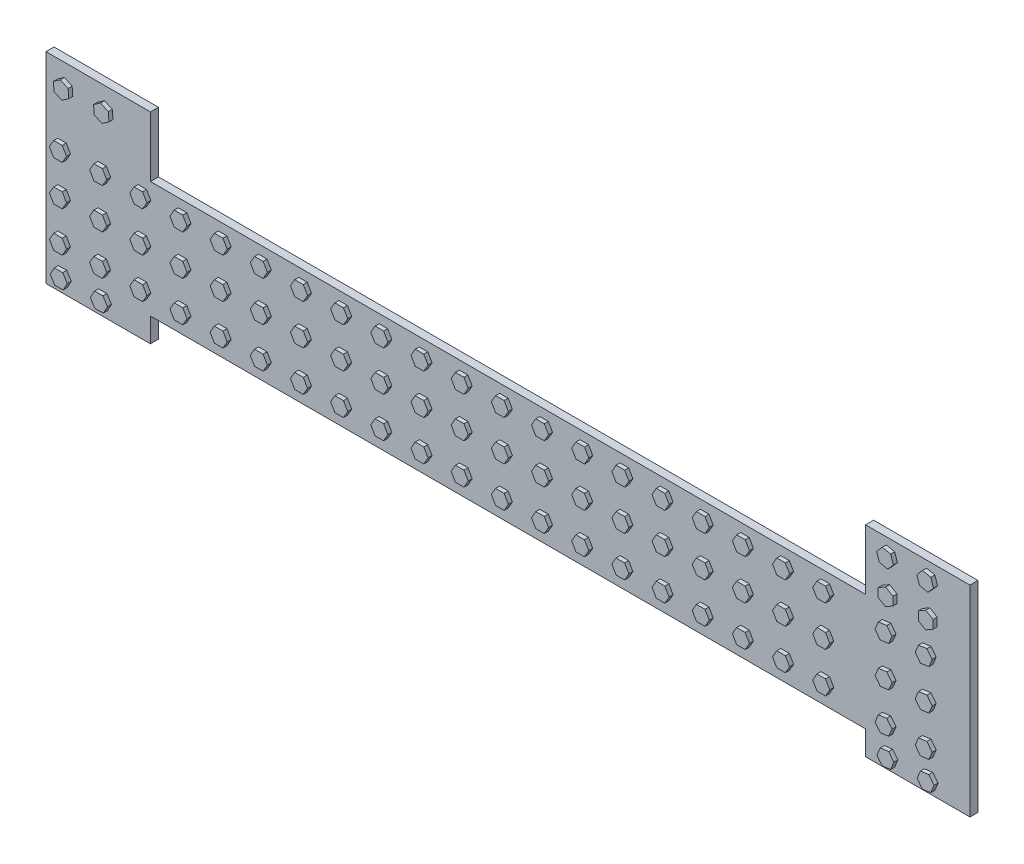
from build123d import *

# Parameters (mm, degrees)
BOSS_EXTRUDE1_DEPTH = 3
CUT_EXTRUDE1_DEPTH  = 1


with BuildPart() as part:
    # Sketch1 → Boss-Extrude1 (new body)
    with BuildSketch(Plane.XY):
        Polygon((-145.118471413, -8.261831079), (-119.118471413, -8.261831079), (-119.118471413, -2.261831079), (58.881528587, -2.261831079), (58.881528587, -8.261831079), (84.881528587, -8.261831079), (84.881528587, 41.738168921), (58.881528587, 41.738168921), (58.881528587, 26.738168921), (-119.118471413, 26.738168921), (-119.118471413, 41.738168921), (-145.118471413, 41.738168921), align=None)
    extrude(amount=BOSS_EXTRUDE1_DEPTH)

    # Sketch2 → Cut-Extrude1 (cut)
    with BuildSketch(Plane.XY.offset(3)):
        Polygon((-119.118471413, 41.738168921), (-145.118471413, 41.738168921), (-145.118471413, -8.261831079), (-119.118471413, -8.261831079), (-119.118471413, -2.261831079), (58.881528587, -2.261831079), (58.881528587, -8.261831079), (84.881528587, -8.261831079), (84.881528587, 41.738168921), (58.881528587, 41.738168921), (58.881528587, 26.738168921), (-119.118471413, 26.738168921), align=None)
        Polygon((-138.824625143, -4.614088966), (-139.830399979, -6.485599135), (-141.954062746, -6.550327661), (-143.071950678, -4.743546018), (-142.066175842, -2.872035849), (-139.942513075, -2.807307323), align=None, mode=Mode.SUBTRACT)
        Polygon((-128.824625143, -4.614088966), (-129.830399979, -6.485599135), (-131.954062746, -6.550327661), (-133.071950678, -4.743546018), (-132.066175842, -2.872035849), (-129.942513075, -2.807307323), align=None, mode=Mode.SUBTRACT)
        Polygon((-140.079555425, 4.54025485), (-139.017230929, 2.70025485), (-140.079555425, 0.86025485), (-142.204204415, 0.86025485), (-143.26652891, 2.70025485), (-142.204204415, 4.54025485), align=None, mode=Mode.SUBTRACT)
        Polygon((-130.079555425, 4.54025485), (-129.017230929, 2.70025485), (-130.079555425, 0.86025485), (-132.204204415, 0.86025485), (-133.26652891, 2.70025485), (-132.204204415, 4.54025485), align=None, mode=Mode.SUBTRACT)
        Polygon((-120.079555425, 4.54025485), (-119.017230929, 2.70025485), (-120.079555425, 0.86025485), (-122.204204415, 0.86025485), (-123.26652891, 2.70025485), (-122.204204415, 4.54025485), align=None, mode=Mode.SUBTRACT)
        Polygon((-110.079555425, 4.54025485), (-109.017230929, 2.70025485), (-110.079555425, 0.86025485), (-112.204204415, 0.86025485), (-113.26652891, 2.70025485), (-112.204204415, 4.54025485), align=None, mode=Mode.SUBTRACT)
        Polygon((-100.079555425, 4.54025485), (-99.017230929, 2.70025485), (-100.079555425, 0.86025485), (-102.204204415, 0.86025485), (-103.26652891, 2.70025485), (-102.204204415, 4.54025485), align=None, mode=Mode.SUBTRACT)
        Polygon((-90.079555425, 4.54025485), (-89.017230929, 2.70025485), (-90.079555425, 0.86025485), (-92.204204415, 0.86025485), (-93.26652891, 2.70025485), (-92.204204415, 4.54025485), align=None, mode=Mode.SUBTRACT)
        Polygon((-80.079555425, 4.54025485), (-79.017230929, 2.70025485), (-80.079555425, 0.86025485), (-82.204204415, 0.86025485), (-83.26652891, 2.70025485), (-82.204204415, 4.54025485), align=None, mode=Mode.SUBTRACT)
        Polygon((-70.079555425, 4.54025485), (-69.017230929, 2.70025485), (-70.079555425, 0.86025485), (-72.204204415, 0.86025485), (-73.26652891, 2.70025485), (-72.204204415, 4.54025485), align=None, mode=Mode.SUBTRACT)
        Polygon((-60.079555425, 4.54025485), (-59.017230929, 2.70025485), (-60.079555425, 0.86025485), (-62.204204415, 0.86025485), (-63.26652891, 2.70025485), (-62.204204415, 4.54025485), align=None, mode=Mode.SUBTRACT)
        Polygon((-50.079555425, 4.54025485), (-49.017230929, 2.70025485), (-50.079555425, 0.86025485), (-52.204204415, 0.86025485), (-53.26652891, 2.70025485), (-52.204204415, 4.54025485), align=None, mode=Mode.SUBTRACT)
        Polygon((-40.079555425, 4.54025485), (-39.017230929, 2.70025485), (-40.079555425, 0.86025485), (-42.204204415, 0.86025485), (-43.26652891, 2.70025485), (-42.204204415, 4.54025485), align=None, mode=Mode.SUBTRACT)
        Polygon((-30.079555425, 4.54025485), (-29.017230929, 2.70025485), (-30.079555425, 0.86025485), (-32.204204415, 0.86025485), (-33.26652891, 2.70025485), (-32.204204415, 4.54025485), align=None, mode=Mode.SUBTRACT)
        Polygon((-140.079555425, 14.54025485), (-139.017230929, 12.70025485), (-140.079555425, 10.86025485), (-142.204204415, 10.86025485), (-143.26652891, 12.70025485), (-142.204204415, 14.54025485), align=None, mode=Mode.SUBTRACT)
        Polygon((-130.079555425, 14.54025485), (-129.017230929, 12.70025485), (-130.079555425, 10.86025485), (-132.204204415, 10.86025485), (-133.26652891, 12.70025485), (-132.204204415, 14.54025485), align=None, mode=Mode.SUBTRACT)
        Polygon((-120.079555425, 14.54025485), (-119.017230929, 12.70025485), (-120.079555425, 10.86025485), (-122.204204415, 10.86025485), (-123.26652891, 12.70025485), (-122.204204415, 14.54025485), align=None, mode=Mode.SUBTRACT)
        Polygon((-110.079555425, 14.54025485), (-109.017230929, 12.70025485), (-110.079555425, 10.86025485), (-112.204204415, 10.86025485), (-113.26652891, 12.70025485), (-112.204204415, 14.54025485), align=None, mode=Mode.SUBTRACT)
        Polygon((-100.079555425, 14.54025485), (-99.017230929, 12.70025485), (-100.079555425, 10.86025485), (-102.204204415, 10.86025485), (-103.26652891, 12.70025485), (-102.204204415, 14.54025485), align=None, mode=Mode.SUBTRACT)
        Polygon((-90.079555425, 14.54025485), (-89.017230929, 12.70025485), (-90.079555425, 10.86025485), (-92.204204415, 10.86025485), (-93.26652891, 12.70025485), (-92.204204415, 14.54025485), align=None, mode=Mode.SUBTRACT)
        Polygon((-80.079555425, 14.54025485), (-79.017230929, 12.70025485), (-80.079555425, 10.86025485), (-82.204204415, 10.86025485), (-83.26652891, 12.70025485), (-82.204204415, 14.54025485), align=None, mode=Mode.SUBTRACT)
        Polygon((-70.079555425, 14.54025485), (-69.017230929, 12.70025485), (-70.079555425, 10.86025485), (-72.204204415, 10.86025485), (-73.26652891, 12.70025485), (-72.204204415, 14.54025485), align=None, mode=Mode.SUBTRACT)
        Polygon((-60.079555425, 14.54025485), (-59.017230929, 12.70025485), (-60.079555425, 10.86025485), (-62.204204415, 10.86025485), (-63.26652891, 12.70025485), (-62.204204415, 14.54025485), align=None, mode=Mode.SUBTRACT)
        Polygon((-50.079555425, 14.54025485), (-49.017230929, 12.70025485), (-50.079555425, 10.86025485), (-52.204204415, 10.86025485), (-53.26652891, 12.70025485), (-52.204204415, 14.54025485), align=None, mode=Mode.SUBTRACT)
        Polygon((-40.079555425, 14.54025485), (-39.017230929, 12.70025485), (-40.079555425, 10.86025485), (-42.204204415, 10.86025485), (-43.26652891, 12.70025485), (-42.204204415, 14.54025485), align=None, mode=Mode.SUBTRACT)
        Polygon((-30.079555425, 14.54025485), (-29.017230929, 12.70025485), (-30.079555425, 10.86025485), (-32.204204415, 10.86025485), (-33.26652891, 12.70025485), (-32.204204415, 14.54025485), align=None, mode=Mode.SUBTRACT)
        Polygon((-20.079555425, 4.54025485), (-19.017230929, 2.70025485), (-20.079555425, 0.86025485), (-22.204204415, 0.86025485), (-23.26652891, 2.70025485), (-22.204204415, 4.54025485), align=None, mode=Mode.SUBTRACT)
        Polygon((-10.079555425, 4.54025485), (-9.017230929, 2.70025485), (-10.079555425, 0.86025485), (-12.204204415, 0.86025485), (-13.26652891, 2.70025485), (-12.204204415, 4.54025485), align=None, mode=Mode.SUBTRACT)
        Polygon((-0.079555425, 4.54025485), (0.982769071, 2.70025485), (-0.079555425, 0.86025485), (-2.204204415, 0.86025485), (-3.26652891, 2.70025485), (-2.204204415, 4.54025485), align=None, mode=Mode.SUBTRACT)
        Polygon((9.920444575, 4.54025485), (10.982769071, 2.70025485), (9.920444575, 0.86025485), (7.795795585, 0.86025485), (6.73347109, 2.70025485), (7.795795585, 4.54025485), align=None, mode=Mode.SUBTRACT)
        Polygon((19.920444575, 4.54025485), (20.982769071, 2.70025485), (19.920444575, 0.86025485), (17.795795585, 0.86025485), (16.73347109, 2.70025485), (17.795795585, 4.54025485), align=None, mode=Mode.SUBTRACT)
        Polygon((66.939017418, -4.92530009), (66.132120882, -6.890764746), (64.026530291, -7.174704175), (62.727836237, -5.493178949), (63.534732773, -3.527714293), (65.640323363, -3.243774863), align=None, mode=Mode.SUBTRACT)
        Polygon((76.939017418, -4.92530009), (76.132120882, -6.890764746), (74.026530291, -7.174704175), (72.727836237, -5.493178949), (73.534732773, -3.527714293), (75.640323363, -3.243774863), align=None, mode=Mode.SUBTRACT)
        Polygon((29.920444575, 4.54025485), (30.982769071, 2.70025485), (29.920444575, 0.86025485), (27.795795585, 0.86025485), (26.73347109, 2.70025485), (27.795795585, 4.54025485), align=None, mode=Mode.SUBTRACT)
        Polygon((39.920444575, 4.54025485), (40.982769071, 2.70025485), (39.920444575, 0.86025485), (37.795795585, 0.86025485), (36.73347109, 2.70025485), (37.795795585, 4.54025485), align=None, mode=Mode.SUBTRACT)
        Polygon((49.920444575, 4.54025485), (50.982769071, 2.70025485), (49.920444575, 0.86025485), (47.795795585, 0.86025485), (46.73347109, 2.70025485), (47.795795585, 4.54025485), align=None, mode=Mode.SUBTRACT)
        Polygon((66.470851926, 1.985815924), (65.655785352, 0.02372525), (63.549031697, -0.251451729), (62.257344616, 1.435461967), (63.072411189, 3.397552641), (65.179164844, 3.67272962), align=None, mode=Mode.SUBTRACT)
        Polygon((76.470851926, 1.985815924), (75.655785352, 0.02372525), (73.549031697, -0.251451729), (72.257344616, 1.435461967), (73.072411189, 3.397552641), (75.179164844, 3.67272962), align=None, mode=Mode.SUBTRACT)
        Polygon((-20.079555425, 14.54025485), (-19.017230929, 12.70025485), (-20.079555425, 10.86025485), (-22.204204415, 10.86025485), (-23.26652891, 12.70025485), (-22.204204415, 14.54025485), align=None, mode=Mode.SUBTRACT)
        Polygon((-10.079555425, 14.54025485), (-9.017230929, 12.70025485), (-10.079555425, 10.86025485), (-12.204204415, 10.86025485), (-13.26652891, 12.70025485), (-12.204204415, 14.54025485), align=None, mode=Mode.SUBTRACT)
        Polygon((-0.079555425, 14.54025485), (0.982769071, 12.70025485), (-0.079555425, 10.86025485), (-2.204204415, 10.86025485), (-3.26652891, 12.70025485), (-2.204204415, 14.54025485), align=None, mode=Mode.SUBTRACT)
        Polygon((9.920444575, 14.54025485), (10.982769071, 12.70025485), (9.920444575, 10.86025485), (7.795795585, 10.86025485), (6.73347109, 12.70025485), (7.795795585, 14.54025485), align=None, mode=Mode.SUBTRACT)
        Polygon((19.920444575, 14.54025485), (20.982769071, 12.70025485), (19.920444575, 10.86025485), (17.795795585, 10.86025485), (16.73347109, 12.70025485), (17.795795585, 14.54025485), align=None, mode=Mode.SUBTRACT)
        Polygon((29.920444575, 14.54025485), (30.982769071, 12.70025485), (29.920444575, 10.86025485), (27.795795585, 10.86025485), (26.73347109, 12.70025485), (27.795795585, 14.54025485), align=None, mode=Mode.SUBTRACT)
        Polygon((39.920444575, 14.54025485), (40.982769071, 12.70025485), (39.920444575, 10.86025485), (37.795795585, 10.86025485), (36.73347109, 12.70025485), (37.795795585, 14.54025485), align=None, mode=Mode.SUBTRACT)
        Polygon((49.920444575, 14.54025485), (50.982769071, 12.70025485), (49.920444575, 10.86025485), (47.795795585, 10.86025485), (46.73347109, 12.70025485), (47.795795585, 14.54025485), align=None, mode=Mode.SUBTRACT)
        Polygon((66.470851926, 11.985815924), (65.655785352, 10.02372525), (63.549031697, 9.748548271), (62.257344616, 11.435461967), (63.072411189, 13.397552641), (65.179164844, 13.67272962), align=None, mode=Mode.SUBTRACT)
        Polygon((76.470851926, 11.985815924), (75.655785352, 10.02372525), (73.549031697, 9.748548271), (72.257344616, 11.435461967), (73.072411189, 13.397552641), (75.179164844, 13.67272962), align=None, mode=Mode.SUBTRACT)
        Polygon((-140.079555425, 24.54025485), (-139.017230929, 22.70025485), (-140.079555425, 20.86025485), (-142.204204415, 20.86025485), (-143.26652891, 22.70025485), (-142.204204415, 24.54025485), align=None, mode=Mode.SUBTRACT)
        Polygon((-130.079555425, 24.54025485), (-129.017230929, 22.70025485), (-130.079555425, 20.86025485), (-132.204204415, 20.86025485), (-133.26652891, 22.70025485), (-132.204204415, 24.54025485), align=None, mode=Mode.SUBTRACT)
        Polygon((-120.079555425, 24.54025485), (-119.017230929, 22.70025485), (-120.079555425, 20.86025485), (-122.204204415, 20.86025485), (-123.26652891, 22.70025485), (-122.204204415, 24.54025485), align=None, mode=Mode.SUBTRACT)
        Polygon((-110.079555425, 24.54025485), (-109.017230929, 22.70025485), (-110.079555425, 20.86025485), (-112.204204415, 20.86025485), (-113.26652891, 22.70025485), (-112.204204415, 24.54025485), align=None, mode=Mode.SUBTRACT)
        Polygon((-100.079555425, 24.54025485), (-99.017230929, 22.70025485), (-100.079555425, 20.86025485), (-102.204204415, 20.86025485), (-103.26652891, 22.70025485), (-102.204204415, 24.54025485), align=None, mode=Mode.SUBTRACT)
        Polygon((-90.079555425, 24.54025485), (-89.017230929, 22.70025485), (-90.079555425, 20.86025485), (-92.204204415, 20.86025485), (-93.26652891, 22.70025485), (-92.204204415, 24.54025485), align=None, mode=Mode.SUBTRACT)
        Polygon((-80.079555425, 24.54025485), (-79.017230929, 22.70025485), (-80.079555425, 20.86025485), (-82.204204415, 20.86025485), (-83.26652891, 22.70025485), (-82.204204415, 24.54025485), align=None, mode=Mode.SUBTRACT)
        Polygon((-70.079555425, 24.54025485), (-69.017230929, 22.70025485), (-70.079555425, 20.86025485), (-72.204204415, 20.86025485), (-73.26652891, 22.70025485), (-72.204204415, 24.54025485), align=None, mode=Mode.SUBTRACT)
        Polygon((-60.079555425, 24.54025485), (-59.017230929, 22.70025485), (-60.079555425, 20.86025485), (-62.204204415, 20.86025485), (-63.26652891, 22.70025485), (-62.204204415, 24.54025485), align=None, mode=Mode.SUBTRACT)
        Polygon((-50.079555425, 24.54025485), (-49.017230929, 22.70025485), (-50.079555425, 20.86025485), (-52.204204415, 20.86025485), (-53.26652891, 22.70025485), (-52.204204415, 24.54025485), align=None, mode=Mode.SUBTRACT)
        Polygon((-40.079555425, 24.54025485), (-39.017230929, 22.70025485), (-40.079555425, 20.86025485), (-42.204204415, 20.86025485), (-43.26652891, 22.70025485), (-42.204204415, 24.54025485), align=None, mode=Mode.SUBTRACT)
        Polygon((-30.079555425, 24.54025485), (-29.017230929, 22.70025485), (-30.079555425, 20.86025485), (-32.204204415, 20.86025485), (-33.26652891, 22.70025485), (-32.204204415, 24.54025485), align=None, mode=Mode.SUBTRACT)
        Polygon((-138.442735474, 35.430185978), (-140.188158422, 34.218727325), (-142.110023864, 35.124578612), (-142.286466359, 37.241888551), (-140.541043411, 38.453347204), (-138.619177969, 37.547495917), align=None, mode=Mode.SUBTRACT)
        Polygon((-128.442735474, 35.430185978), (-130.188158422, 34.218727325), (-132.110023864, 35.124578612), (-132.286466359, 37.241888551), (-130.541043412, 38.453347204), (-128.619177969, 37.547495917), align=None, mode=Mode.SUBTRACT)
        Polygon((-20.079555425, 24.54025485), (-19.017230929, 22.70025485), (-20.079555425, 20.86025485), (-22.204204415, 20.86025485), (-23.26652891, 22.70025485), (-22.204204415, 24.54025485), align=None, mode=Mode.SUBTRACT)
        Polygon((-10.079555425, 24.54025485), (-9.017230929, 22.70025485), (-10.079555425, 20.86025485), (-12.204204415, 20.86025485), (-13.26652891, 22.70025485), (-12.204204415, 24.54025485), align=None, mode=Mode.SUBTRACT)
        Polygon((-0.079555425, 24.54025485), (0.982769071, 22.70025485), (-0.079555425, 20.86025485), (-2.204204415, 20.86025485), (-3.26652891, 22.70025485), (-2.204204415, 24.54025485), align=None, mode=Mode.SUBTRACT)
        Polygon((9.920444575, 24.54025485), (10.982769071, 22.70025485), (9.920444575, 20.86025485), (7.795795585, 20.86025485), (6.73347109, 22.70025485), (7.795795585, 24.54025485), align=None, mode=Mode.SUBTRACT)
        Polygon((19.920444575, 24.54025485), (20.982769071, 22.70025485), (19.920444575, 20.86025485), (17.795795585, 20.86025485), (16.73347109, 22.70025485), (17.795795585, 24.54025485), align=None, mode=Mode.SUBTRACT)
        Polygon((29.920444575, 24.54025485), (30.982769071, 22.70025485), (29.920444575, 20.86025485), (27.795795585, 20.86025485), (26.73347109, 22.70025485), (27.795795585, 24.54025485), align=None, mode=Mode.SUBTRACT)
        Polygon((39.920444575, 24.54025485), (40.982769071, 22.70025485), (39.920444575, 20.86025485), (37.795795585, 20.86025485), (36.73347109, 22.70025485), (37.795795585, 24.54025485), align=None, mode=Mode.SUBTRACT)
        Polygon((49.920444575, 24.54025485), (50.982769071, 22.70025485), (49.920444575, 20.86025485), (47.795795585, 20.86025485), (46.73347109, 22.70025485), (47.795795585, 24.54025485), align=None, mode=Mode.SUBTRACT)
        Polygon((66.470851926, 21.985815924), (65.655785352, 20.02372525), (63.549031697, 19.748548271), (62.257344616, 21.435461967), (63.072411189, 23.397552641), (65.179164844, 23.67272962), align=None, mode=Mode.SUBTRACT)
        Polygon((76.470851926, 21.985815924), (75.655785352, 20.02372525), (73.549031697, 19.748548271), (72.257344616, 21.435461967), (73.072411189, 23.397552641), (75.179164844, 23.67272962), align=None, mode=Mode.SUBTRACT)
        Polygon((66.708549849, 28.641888809), (64.868549849, 27.579564313), (63.028549849, 28.641888809), (63.028549849, 30.766537799), (64.868549849, 31.828862295), (66.708549849, 30.766537799), align=None, mode=Mode.SUBTRACT)
        Polygon((76.708549849, 28.641888809), (74.868549849, 27.579564313), (73.028549849, 28.641888809), (73.028549849, 30.766537799), (74.868549849, 31.828862295), (76.708549849, 30.766537799), align=None, mode=Mode.SUBTRACT)
        Polygon((66.817709133, 37.536822129), (65.408068367, 35.947153534), (63.326554596, 36.37310395), (62.654681593, 38.388722962), (64.064322359, 39.978391557), (66.145836129, 39.552441141), align=None, mode=Mode.SUBTRACT)
        Polygon((76.817709133, 37.536822129), (75.408068367, 35.947153534), (73.326554596, 36.37310395), (72.654681593, 38.388722962), (74.064322359, 39.978391557), (76.145836129, 39.552441141), align=None, mode=Mode.SUBTRACT)
    extrude(amount=-CUT_EXTRUDE1_DEPTH, mode=Mode.SUBTRACT)


solid = part.part
